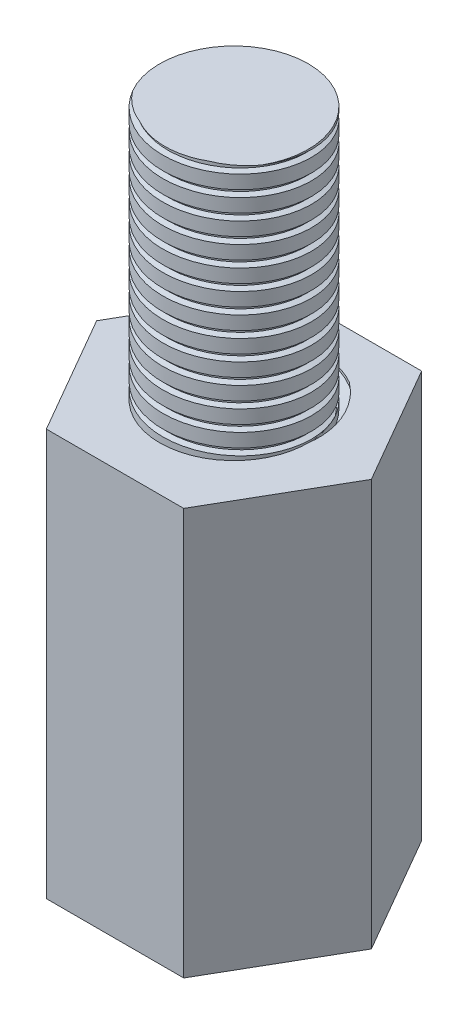
from build123d import *

# Parameters (mm, degrees)
SKETCH_1_R          = 1.46
EXTRUDE_1_DEPTH     = 8
SKETCH_1_3_R        = 1.46
CUT_EXTRUDE_1_DEPTH = 5
SKETCH_2_R          = 1.46
EXTRUDE_2_DEPTH     = 5
SWEEP_1_PITCH       = 0.4
SWEEP_1_FROM        = -0.1
SWEEP_2_PITCH       = 0.4


with BuildPart() as part:
    # 草图1 → 凸台-拉伸1 (new body)
    # profile 1 of 2: a face of its own
    with BuildSketch(Plane(origin=(0, 0, 0), x_dir=(1, 0, 0), z_dir=(0, 1, 0))):
        Polygon((-2.70199926, 0), (-1.35099963, -2.34), (1.35099963, -2.34), (2.70199926, 0), (1.35099963, 2.34), (-1.35099963, 2.34), align=None)
        Circle(SKETCH_1_R, mode=Mode.SUBTRACT)
    # profile 2 of 2: a face of its own
    with BuildSketch(Plane(origin=(0, 0, 0), x_dir=(1, 0, 0), z_dir=(0, 1, 0))):
        Circle(SKETCH_1_R)
    extrude(amount=EXTRUDE_1_DEPTH)

    # 草图1<3> → 切除-拉伸1 (cut)
    with BuildSketch(Plane(origin=(0, 0, 0), x_dir=(1, 0, 0), z_dir=(0, 1, 0))):
        with Locations(Location((0, 0, 0), (0, 0, 270))):
            Circle(SKETCH_1_3_R)
    extrude(amount=CUT_EXTRUDE_1_DEPTH, mode=Mode.SUBTRACT)

    # 切除-扫描2: arcs per turn and ends read off the stored shape
    # 切除-扫描2: the profile of 草图7 profile screwed along a right-hand helix through 23.75 turns, 6 arcs to a turn; built about Z, then put on its axis
    sweep_2_z = Axis((0, 0, 0), (0, 0, 1))
    sweep_2_corners = [(1.4597, 0, 0.1001), (1.66, 0, 0.033333333), (1.66, 0, -0.033333333), (1.4597, 0, -0.1001)]
    with BuildLine(mode=Mode.PRIVATE) as sweep_2_profile:
        Line(sweep_2_corners[0], sweep_2_corners[1])
        Line(sweep_2_corners[1], sweep_2_corners[2])
        Line(sweep_2_corners[2], sweep_2_corners[3])
        Line(sweep_2_corners[3], sweep_2_corners[0])
    sweep_2_cap = Face(sweep_2_profile.wire())
    sweep_2_turn_angles = [0, 30, 60, 90, 120, 150, 180, 210, 240, 270, 300, 330, 360]
    sweep_2_turn_weights = [1, 0.8660254037844387, 1, 0.8660254037844387, 1, 0.8660254037844387, 1, 0.8660254037844387, 1, 0.8660254037844387, 1, 0.8660254037844387, 1]
    sweep_2_turn_rails = [Edge.make_bspline([Vector(p[0], p[1], 0).rotate(sweep_2_z, sweep_2_turn_angles[k]) / sweep_2_turn_weights[k] + Vector(0, 0, p[2] + SWEEP_2_PITCH * sweep_2_turn_angles[k] / 360) for k in range(13)], [0, 0, 0, 1, 1, 2, 2, 3, 3, 4, 4, 5, 5, 6, 6, 6], 2, sweep_2_turn_weights) for p in sweep_2_corners]
    sweep_2_turn_sides = [Face.make_surface_from_curves(sweep_2_turn_rails[p[0]], sweep_2_turn_rails[p[1]]) for p in [(0, 1), (1, 2), (2, 3), (3, 0)]]
    sweep_2_last_angles = [8280, 8310, 8340, 8370, 8400, 8430, 8460, 8490, 8520, 8535, 8550]
    sweep_2_last_weights = [1, 0.8660254037844387, 1, 0.8660254037844387, 1, 0.8660254037844387, 1, 0.8660254037844387, 1, 0.965925826289056, 1]
    sweep_2_last_rails = [Edge.make_bspline([Vector(p[0], p[1], 0).rotate(sweep_2_z, sweep_2_last_angles[k]) / sweep_2_last_weights[k] + Vector(0, 0, p[2] + SWEEP_2_PITCH * sweep_2_last_angles[k] / 360) for k in range(11)], [0, 0, 0, 1, 1, 2, 2, 3, 3, 4, 4, 5, 5, 5], 2, sweep_2_last_weights) for p in sweep_2_corners]
    sweep_2_last_sides = [Face.make_surface_from_curves(sweep_2_last_rails[p[0]], sweep_2_last_rails[p[1]]) for p in [(0, 1), (1, 2), (2, 3), (3, 0)]]
    sweep_2 = Plane(origin=(0, 0, 0), x_dir=(0, 0, -1), z_dir=(0, 1, 0)) * Solid(Shell([*[p.moved(Location((0, 0, SWEEP_2_PITCH * i))) for i in range(23) for p in sweep_2_turn_sides], *sweep_2_last_sides, sweep_2_cap, sweep_2_cap.rotate(sweep_2_z, 8550).moved(Location((0, 0, SWEEP_2_PITCH * 8550 / 360)))]))
    add(sweep_2, mode=Mode.SUBTRACT)


with BuildPart() as body_2:
    # 草图2 → 凸台-拉伸2 (new body)
    with BuildSketch(Plane(origin=(0, 8, 0), x_dir=(1, 0, 0), z_dir=(0, 1, 0))):
        with Locations(Location((0, 0, 0), (0, 0, 270))):
            Circle(SKETCH_2_R)
    extrude(amount=EXTRUDE_2_DEPTH)

    # 切除-扫描1: arcs per turn and ends read off the stored shape
    # 切除-扫描1: the profile of 草图4 screwed along a left-hand helix through 18.75 turns, 6 arcs to a turn; built about Z, then put on its axis
    sweep_1_z = Axis((0, 0, 0), (0, 0, 1))
    sweep_1_corners = [(1.56, 5.45e-07, -0.400000022), (1.56, 5.45e-07, -0.200000022), (1.36, 4.75e-07, -0.266666689), (1.36, 4.75e-07, -0.333333356)]
    with BuildLine(mode=Mode.PRIVATE) as sweep_1_profile:
        Line(sweep_1_corners[0], sweep_1_corners[1])
        Line(sweep_1_corners[1], sweep_1_corners[2])
        Line(sweep_1_corners[2], sweep_1_corners[3])
        Line(sweep_1_corners[3], sweep_1_corners[0])
    sweep_1_cap = Face(sweep_1_profile.wire())
    sweep_1_turn_angles = [0, -30, -60, -90, -120, -150, -180, -210, -240, -270, -300, -330, -360]
    sweep_1_turn_weights = [1, 0.8660254037844387, 1, 0.8660254037844387, 1, 0.8660254037844387, 1, 0.8660254037844387, 1, 0.8660254037844387, 1, 0.8660254037844387, 1]
    sweep_1_turn_rails = [Edge.make_bspline([Vector(p[0], p[1], 0).rotate(sweep_1_z, sweep_1_turn_angles[k]) / sweep_1_turn_weights[k] + Vector(0, 0, p[2] + -SWEEP_1_PITCH * sweep_1_turn_angles[k] / 360) for k in range(13)], [0, 0, 0, 1, 1, 2, 2, 3, 3, 4, 4, 5, 5, 6, 6, 6], 2, sweep_1_turn_weights) for p in sweep_1_corners]
    sweep_1_turn_sides = [Face.make_surface_from_curves(sweep_1_turn_rails[p[0]], sweep_1_turn_rails[p[1]]) for p in [(0, 1), (1, 2), (2, 3), (3, 0)]]
    sweep_1_last_angles = [-6480, -6510, -6540, -6570, -6600, -6630, -6660, -6690, -6720, -6735, -6750]
    sweep_1_last_weights = [1, 0.8660254037844387, 1, 0.8660254037844387, 1, 0.8660254037844387, 1, 0.8660254037844387, 1, 0.965925826288941, 1]
    sweep_1_last_rails = [Edge.make_bspline([Vector(p[0], p[1], 0).rotate(sweep_1_z, sweep_1_last_angles[k]) / sweep_1_last_weights[k] + Vector(0, 0, p[2] + -SWEEP_1_PITCH * sweep_1_last_angles[k] / 360) for k in range(11)], [0, 0, 0, 1, 1, 2, 2, 3, 3, 4, 4, 5, 5, 5], 2, sweep_1_last_weights) for p in sweep_1_corners]
    sweep_1_last_sides = [Face.make_surface_from_curves(sweep_1_last_rails[p[0]], sweep_1_last_rails[p[1]]) for p in [(0, 1), (1, 2), (2, 3), (3, 0)]]
    sweep_1 = Plane(origin=(0, 8.1, 0), x_dir=(0, 0, 1), z_dir=(0, 1, 0)) * split(Solid(Shell([*[p.moved(Location((0, 0, SWEEP_1_PITCH * i))) for i in range(18) for p in sweep_1_turn_sides], *sweep_1_last_sides, sweep_1_cap, sweep_1_cap.rotate(sweep_1_z, -6750).moved(Location((0, 0, -SWEEP_1_PITCH * -6750 / 360)))])), bisect_by=Plane.XY.offset(SWEEP_1_FROM), keep=Keep.TOP, mode=Mode.PRIVATE)
    add(sweep_1, mode=Mode.SUBTRACT)


solid = Compound([part.part, body_2.part])
